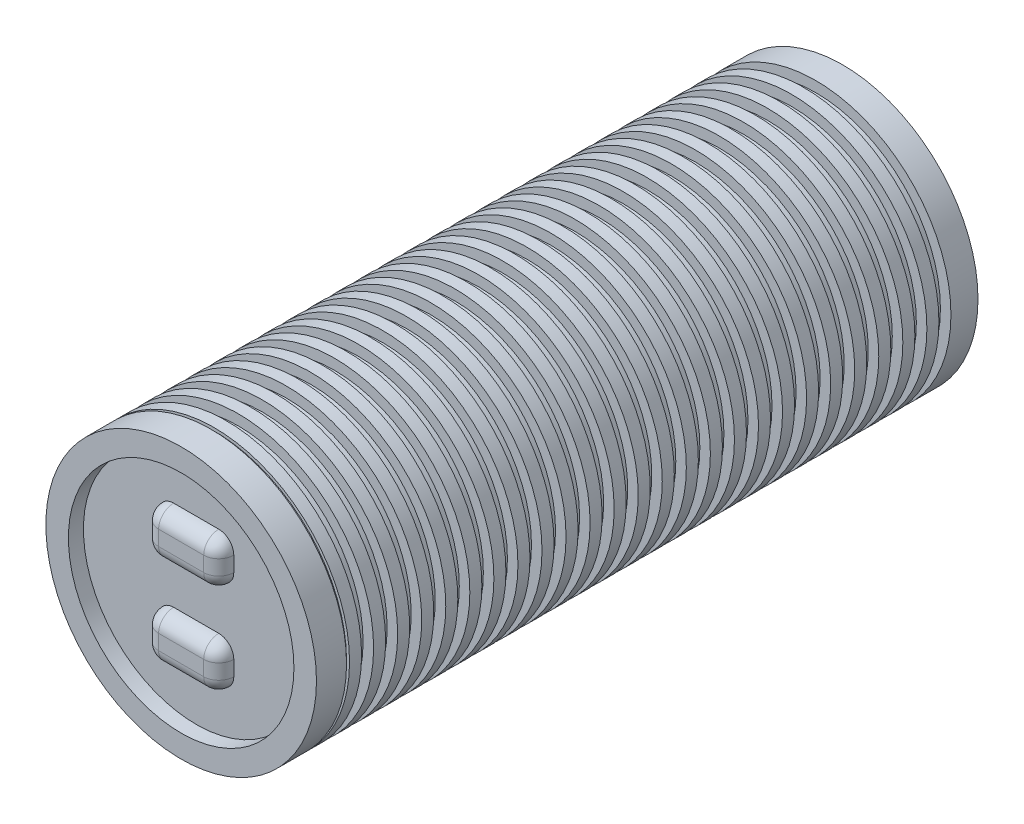
from build123d import *

# Parameters (mm, degrees)
BOSS_EXTRU_1_DEPTH = 1
CONG_1_R           = 1


with BuildPart() as part:
    # Esquisse1 → Révolution1 (revolve)
    with BuildSketch(Plane(origin=(0, 0, 0), x_dir=(0, 0, -1), z_dir=(1, 0, 0)), mode=Mode.PRIVATE) as r_volution1_sk:
        Polygon((3, 9), (3, 8.3), (3.8, 8.3), (3.8, 9), (4.6, 9), (4.6, 8.3), (5.4, 8.3), (5.4, 9), (6.2, 9), (6.2, 8.3), (7, 8.3), (7, 9), (7.8, 9), (7.8, 8.3), (8.6, 8.3), (8.6, 9), (9.4, 9), (9.4, 8.3), (10.2, 8.3), (10.2, 9), (11, 9), (11, 8.3), (11.8, 8.3), (11.8, 9), (12.6, 9), (12.6, 8.3), (13.4, 8.3), (13.4, 9), (14.2, 9), (14.2, 8.3), (15, 8.3), (15, 9), (15.8, 9), (15.8, 8.3), (16.6, 8.3), (16.6, 9), (17.4, 9), (17.4, 8.3), (18.2, 8.3), (18.2, 9), (19, 9), (19, 8.3), (19.8, 8.3), (19.8, 9), (20.6, 9), (20.6, 8.3), (21.4, 8.3), (21.4, 9), (22.2, 9), (22.2, 8.3), (23, 8.3), (23, 9), (23.8, 9), (23.8, 8.3), (24.6, 8.3), (24.6, 9), (25.4, 9), (25.4, 8.3), (26.2, 8.3), (26.2, 9), (27, 9), (27, 8.3), (27.8, 8.3), (27.8, 9), (28.6, 9), (28.6, 8.3), (29.4, 8.3), (29.4, 9), (30.2, 9), (30.2, 8.3), (31, 8.3), (31, 9), (31.8, 9), (31.8, 8.3), (32.6, 8.3), (32.6, 9), (33.4, 9), (33.4, 8.3), (34.2, 8.3), (34.2, 9), (35, 9), (35, 8.3), (35.8, 8.3), (35.8, 9), (36.6, 9), (36.6, 8.3), (37.4, 8.3), (37.4, 9), (38.2, 9), (38.2, 8.3), (39, 8.3), (39, 9), (39.8, 9), (39.8, 8.3), (40.6, 8.3), (40.6, 9), (41.4, 9), (41.4, 8.3), (42.2, 8.3), (42.2, 9), (44, 9), (44, 0), (1, 0), (1, 7.5), (0, 7.5), (0, 9), (2, 9), (2, 8.8), (2.2, 8.8), (2.2, 9), align=None)
    revolve(r_volution1_sk.sketch.rotate(Axis((0, 0, -1), (0, 0, -1)), 90), axis=Axis((0, 0, -1), (0, 0, -1)))

    # Esquisse2 → Boss.-Extru.1 (add)
    with BuildSketch(Plane.XY.offset(-1)):
        with BuildLine():
            Line((-1.5, 4.5), (1.5, 4.5))
            ThreePointArc((1.5, 4.5), (2.207106781, 4.207106781), (2.5, 3.5))
            Line((2.5, 3.5), (2.5, 2.5))
            ThreePointArc((2.5, 2.5), (2.207106781, 1.792893219), (1.5, 1.5))
            Line((1.5, 1.5), (-1.5, 1.5))
            ThreePointArc((-1.5, 1.5), (-2.207106781, 1.792893219), (-2.5, 2.5))
            Line((-2.5, 2.5), (-2.5, 3.5))
            ThreePointArc((-2.5, 3.5), (-2.207106781, 4.207106781), (-1.5, 4.5))
        make_face()
        with BuildLine():
            Line((1.5, -1.5), (-1.5, -1.5))
            ThreePointArc((-1.5, -1.5), (-2.207106781, -1.792893219), (-2.5, -2.5))
            Line((-2.5, -2.5), (-2.5, -3.5))
            ThreePointArc((-2.5, -3.5), (-2.207106781, -4.207106781), (-1.5, -4.5))
            Line((-1.5, -4.5), (1.5, -4.5))
            ThreePointArc((1.5, -4.5), (2.207106781, -4.207106781), (2.5, -3.5))
            Line((2.5, -3.5), (2.5, -2.5))
            ThreePointArc((2.5, -2.5), (2.207106781, -1.792893219), (1.5, -1.5))
        make_face()
    extrude(amount=BOSS_EXTRU_1_DEPTH)

    # Congé1
    cong_1_edges = [part.edges().sort_by_distance(p)[0] for p in [
        (2.5, -3, 0),
        (2.207106781, -4.207106781, 0),
        (0, -4.5, 0),
        (-2.207106781, -4.207106781, 0),
        (-2.5, -3, 0),
        (-2.207106781, -1.792893219, 0),
        (0, -1.5, 0),
        (2.207106781, -1.792893219, 0),
        (2.5, 3, 0),
        (2.207106781, 1.792893219, 0),
        (0, 1.5, 0),
        (-2.207106781, 1.792893219, 0),
        (-2.5, 3, 0),
        (-2.207106781, 4.207106781, 0),
        (0, 4.5, 0),
        (2.207106781, 4.207106781, 0),
    ]]
    fillet(cong_1_edges, radius=CONG_1_R - 0.0001)  # a hair under: the kernel refuses the full size


solid = part.part
